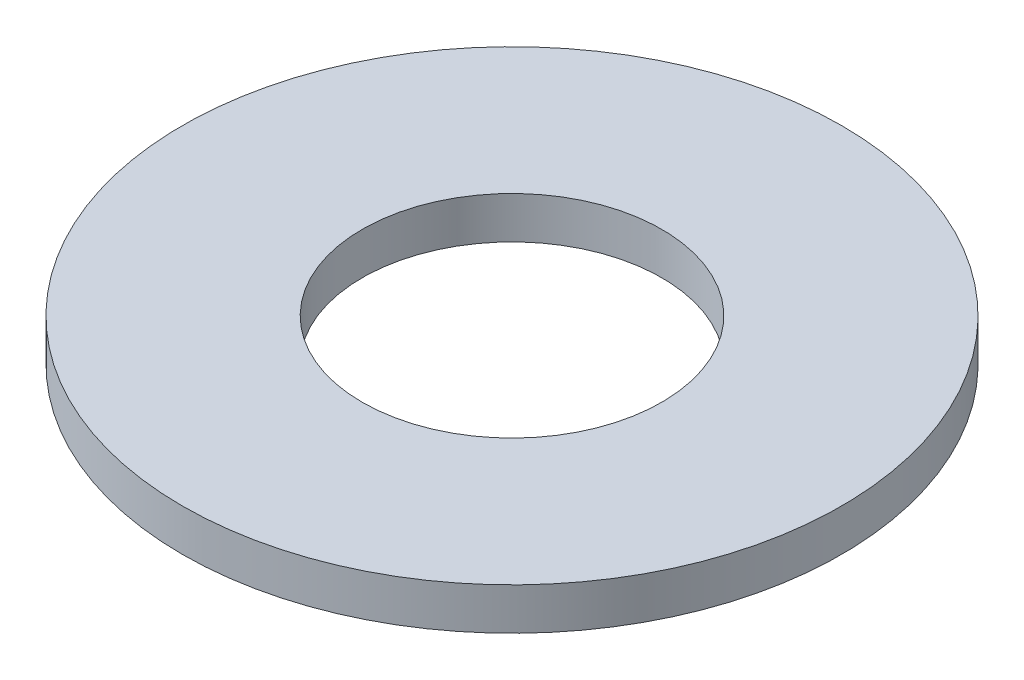
from build123d import *

# Parameters (mm, degrees)
SKETCH1_R           = 55
BOSS_EXTRUDE1_DEPTH = 7
SKETCH2_R           = 25
CUT_EXTRUDE1_DEPTH  = 79.096094653


with BuildPart() as part:
    # Sketch1 → Boss-Extrude1 (new body)
    with BuildSketch(Plane(origin=(0, 0, 0), x_dir=(1, 0, 0), z_dir=(0, 1, 0))):
        Circle(SKETCH1_R)
    extrude(amount=BOSS_EXTRUDE1_DEPTH)

    # Sketch2 → Cut-Extrude1 (cut, through all)
    with BuildSketch(Plane(origin=(0, 0, 0), x_dir=(1, 0, 0), z_dir=(0, 1, 0))):
        Circle(SKETCH2_R)
    extrude(amount=CUT_EXTRUDE1_DEPTH, mode=Mode.SUBTRACT)


solid = part.part
